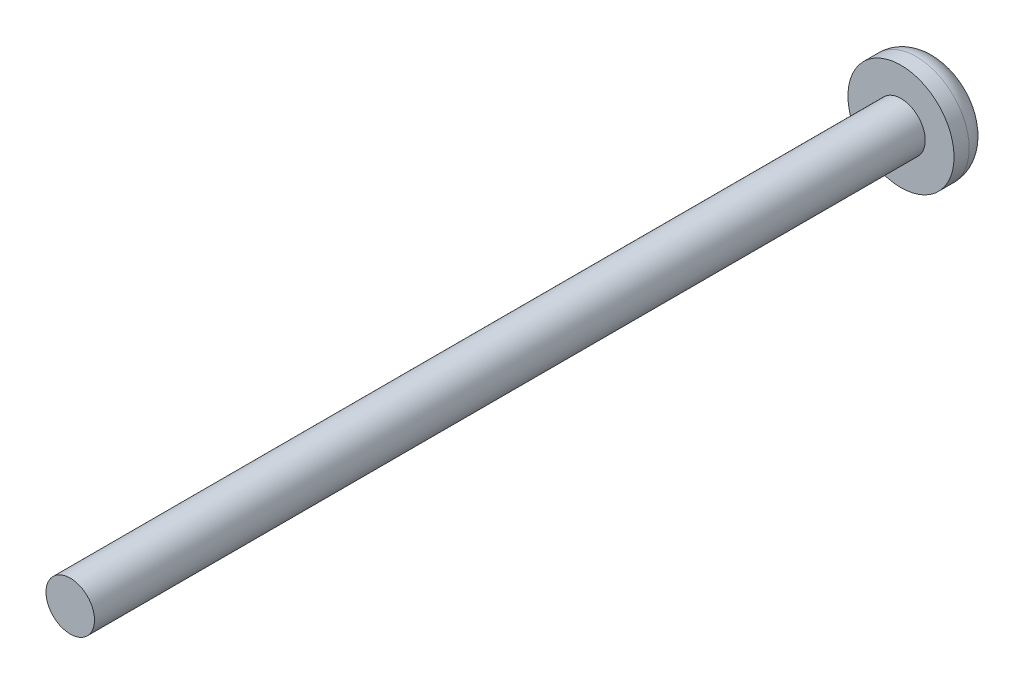
from build123d import *

# Parameters (mm, degrees)
SKETCH_1_R               = 1.75
EXTRUDE_1_DEPTH          = 1.2
SKETCH_2_R               = 0.8
EXTRUDE_2_DEPTH          = 27.4
PATTERN_CIRCULAR_1_COUNT = 4
FILLET_2_R               = 0.7


with BuildPart() as part:
    # 草圖1 → 伸長1 (new body)
    with BuildSketch(Plane.XY):
        Circle(SKETCH_1_R)
    extrude(amount=EXTRUDE_1_DEPTH)

    # 草圖2 → 伸長2 (add)
    with BuildSketch(Plane.XY.offset(1.2)):
        with Locations(Location((0, 0, 0), (0, 0, 180))):
            Circle(SKETCH_2_R)
    extrude(amount=EXTRUDE_2_DEPTH)

    # 草圖3 → 除料-疊層拉伸1 section 0
    with BuildSketch(Plane(origin=(0, 0, 0), x_dir=(-1, 0, 0), z_dir=(0, 0, -1)), mode=Mode.PRIVATE) as loft_1_s0:
        with BuildLine():
            Line((-0.115, 1.2), (0.115, 1.2))
            Line((0.115, 1.2), (0.115, -1.2))
            Line((0.115, -1.2), (-0.115, -1.2))
            Line((-0.115, -1.2), (-0.115, 1.2))
        make_face()
    loft_1 = loft([loft_1_s0.sketch, Vertex(0, 0, 0.85)], mode=Mode.SUBTRACT)

    # 環狀複製排列1: 除料-疊層拉伸1 ×4 about axis
    pattern_circular_1_axis = Axis((0, 0, 0), (0, 0, 1))
    for i in range(1, PATTERN_CIRCULAR_1_COUNT):
        add(loft_1.rotate(pattern_circular_1_axis, i * 360 / PATTERN_CIRCULAR_1_COUNT), mode=Mode.SUBTRACT)

    # 圓角2
    # the kernel refuses this fillet: 0.7 mm, written as the material it takes off along each edge
    with BuildSketch(Plane(origin=(0, 0, 0), x_dir=(1, 0, 0), z_dir=(0, -1, 0))) as fillet_2_piece_1:
        with BuildLine():
            CenterArc((1.75 - FILLET_2_R, FILLET_2_R), FILLET_2_R, 270, 90)
            Line((1.75 - FILLET_2_R, 0), (1.75, 0))
            Line((1.75, 0), (1.75, FILLET_2_R))
        make_face()
    revolve(axis=Axis((0, 0, 0), (0, 0, 1)), mode=Mode.SUBTRACT)


solid = part.part
